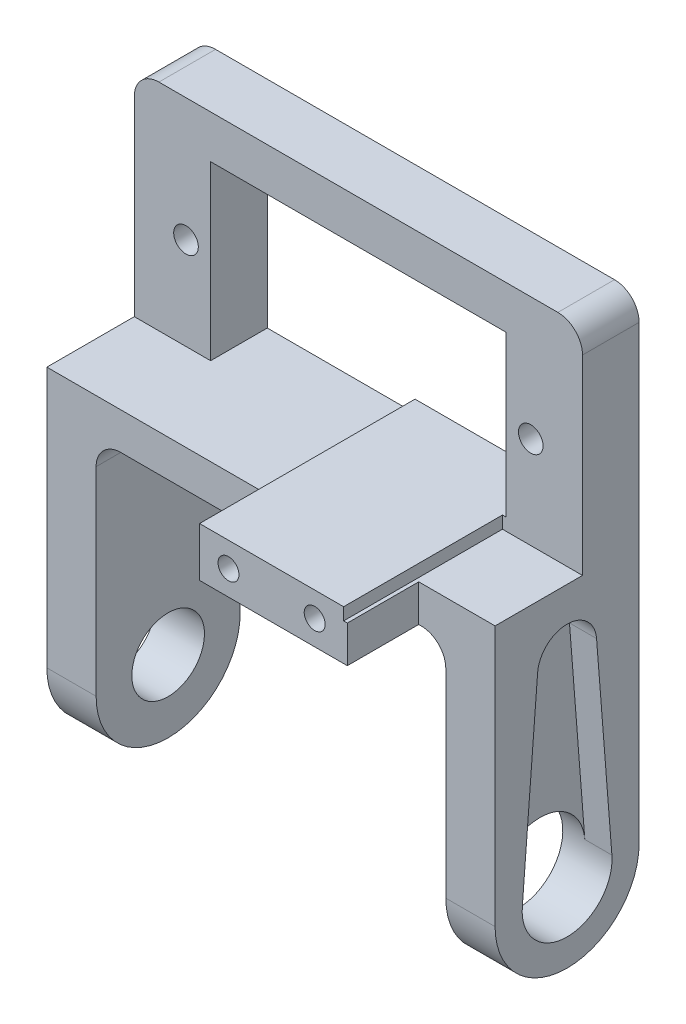
from build123d import *

# Parameters (mm, degrees)
SKETCH_1_R          = 1
EXTRUDE_1_DEPTH     = 4.6
EXTRUDE_2_DEPTH     = 11.7
SKETCH_1_4_W        = 12
SKETCH_1_4_H        = 3
EXTRUDE_3_DEPTH     = 11.7
SKETCH_2_R          = 3.65
CUT_EXTRUDE_1_DEPTH = 24.5
CUT_EXTRUDE_2_DEPTH = 2.2
FILLET_2_R          = 5.85
FILLET_3_R          = 5.85
FILLET_4_R          = 5.85
FILLET_1_R          = 5.85
FILLET_5_R          = 2
FILLET_6_R          = 2
FILLET_8_R          = 2
SKETCH_3_R          = 2.95
CUT_EXTRUDE_3_DEPTH = 10
SKETCH_1_6_R        = 0.85
EXTRUDE_5_DEPTH     = 17.5
FILLET_9_R          = 2
CUT_EXTRUDE_START   = -2.2
CUT_EXTRUDE_4_DEPTH = 2.2
CUT_EXTRUDE_START_2 = -10.2
SKETCH_4_3_R        = 3.65
SKETCH_4_3_R_2      = 2.95
CUT_EXTRUDE_5_DEPTH = 10.2
EXTRUDE_6_DEPTH     = 2.2
SKETCH_2_5_R        = 3.65
EXTRUDE_7_DEPTH     = 4
SKETCH_5_R          = 2.95
CUT_EXTRUDE_6_DEPTH = 8.2


with BuildPart() as part:
    # 草图1 → 凸台-拉伸1 (new body)
    with BuildSketch(Plane.XY):
        Polygon((0, 44.5), (0, 27), (6.2, 27), (6.2, 28), (6.2, 41), (30.2, 41), (30.2, 28), (29.9, 28), (29.9, 27), (30.2, 27), (35, 27), (36.4, 27), (36.4, 44.5), align=None)
        with Locations((4.2, 34.5)):
            Circle(SKETCH_1_R, mode=Mode.SUBTRACT)
        with Locations((32.2, 34.5)):
            Circle(SKETCH_1_R, mode=Mode.SUBTRACT)
    extrude(amount=EXTRUDE_1_DEPTH)

    # 草图1<3> → 凸台-拉伸2 (add)
    with BuildSketch(Plane.XY):
        Polygon((0, 27), (0, 0), (4, 0), (4, 24), (6.2, 24), (6.2, 27), align=None)
        Polygon((36.4, 0), (36.4, 27), (30.2, 27), (30.2, 24), (32.4, 24), (32.4, 0), align=None)
    extrude(amount=EXTRUDE_2_DEPTH)

    # 草图1<4> → 凸台-拉伸3 (add)
    with BuildSketch(Plane.XY):
        with Locations((12.2, 25.5)):
            Rectangle(SKETCH_1_4_W, SKETCH_1_4_H)
    extrude(amount=EXTRUDE_3_DEPTH)

    # 草图2 → 切除-拉伸1 (cut)
    with BuildSketch(Plane.ZY):
        with Locations((5.85, 5.85)):
            Circle(SKETCH_2_R)
    extrude(amount=-CUT_EXTRUDE_1_DEPTH, mode=Mode.SUBTRACT)

    # 草图2<3> → 切除-拉伸2 (cut)
    with BuildSketch(Plane.ZY):
        with BuildLine():
            Line((9.488773874, 6.136050157), (8.242618438, 21.988087774))
            ThreePointArc((8.242618438, 21.988087774), (5.85, 24.2), (3.457381562, 21.988087774))
            Line((3.457381562, 21.988087774), (2.211226126, 6.136050157))
            ThreePointArc((2.211226126, 6.136050157), (5.85, 9.5), (9.488773874, 6.136050157))
        make_face()
    extrude(amount=-CUT_EXTRUDE_2_DEPTH, mode=Mode.SUBTRACT)

    # 圆角2
    fillet_2_edges = [part.edges().sort_by_distance(p)[0] for p in [
        (2, 0, 0),
    ]]
    fillet(fillet_2_edges, radius=FILLET_2_R)

    # 圆角3
    fillet_3_edges = [part.edges().sort_by_distance(p)[0] for p in [
        (34.4, 0, 0),
    ]]
    fillet(fillet_3_edges, radius=FILLET_3_R)

    # 圆角4
    fillet_4_edges = [part.edges().sort_by_distance(p)[0] for p in [
        (34.4, 0, 11.7),
    ]]
    fillet(fillet_4_edges, radius=FILLET_4_R - 0.0001)  # a hair under: the kernel refuses the full size

    # 圆角1
    fillet_1_edges = [part.edges().sort_by_distance(p)[0] for p in [
        (2, 0, 11.7),
    ]]
    fillet(fillet_1_edges, radius=FILLET_1_R - 0.0001)  # a hair under: the kernel refuses the full size

    # 圆角5
    fillet_5_edges = [part.edges().sort_by_distance(p)[0] for p in [
        (0, 44.5, 2.3),
    ]]
    fillet(fillet_5_edges, radius=FILLET_5_R)

    # 圆角6
    fillet_6_edges = [part.edges().sort_by_distance(p)[0] for p in [
        (36.4, 44.5, 2.3),
    ]]
    fillet(fillet_6_edges, radius=FILLET_6_R)

    # 圆角8
    fillet_8_edges = [part.edges().sort_by_distance(p)[0] for p in [
        (4, 24, 5.85),
    ]]
    fillet(fillet_8_edges, radius=FILLET_8_R)

    # 草图3 → 切除-拉伸3 (cut)
    with BuildSketch(Plane(origin=(36.4, 0, 0), x_dir=(0, 0, -1), z_dir=(1, 0, 0))):
        with Locations(Location((-5.85, 5.85, 0), (0, 0, 90))):
            Circle(SKETCH_3_R)
    extrude(amount=-CUT_EXTRUDE_3_DEPTH, mode=Mode.SUBTRACT)

    # 草图1<6> → 凸台-拉伸5 (add)
    with BuildSketch(Plane.XY):
        Polygon((18.2, 28), (18.2, 27), (18.2, 24), (30.2, 24), (30.2, 27), (29.9, 27), (29.9, 28), align=None)
        with Locations((20.55, 26)):
            Circle(SKETCH_1_6_R, mode=Mode.SUBTRACT)
        with Locations((27.55, 26)):
            Circle(SKETCH_1_6_R, mode=Mode.SUBTRACT)
    extrude(amount=EXTRUDE_5_DEPTH)

    # 圆角9
    fillet_9_edges = [part.edges().sort_by_distance(p)[0] for p in [
        (32.4, 24, 5.85),
    ]]
    fillet(fillet_9_edges, radius=FILLET_9_R)

    # 草图4 → 切除-拉伸4 (cut)
    with BuildSketch(Plane(origin=(36.4, 0, 0), x_dir=(0, 0, -1), z_dir=(1, 0, 0)).offset(CUT_EXTRUDE_START)):
        with BuildLine():
            ThreePointArc((-3.457381562, 21.988087774), (-5.85, 24.2), (-8.242618438, 21.988087774))
            Line((-8.242618438, 21.988087774), (-9.488773874, 6.136050157))
            ThreePointArc((-9.488773874, 6.136050157), (-5.85, 9.5), (-2.211226126, 6.136050157))
            Line((-2.211226126, 6.136050157), (-3.457381562, 21.988087774))
        make_face()
    extrude(amount=CUT_EXTRUDE_4_DEPTH, mode=Mode.SUBTRACT)

    # 草图4<3> → 切除-拉伸5 (cut)
    with BuildSketch(Plane(origin=(36.4, 0, 0), x_dir=(0, 0, -1), z_dir=(1, 0, 0)).offset(CUT_EXTRUDE_START_2)):
        with Locations(Location((-5.85, 5.85, 0), (0, 0, 175.505125981))):
            Circle(SKETCH_4_3_R)
        with Locations((-5.85, 5.85)):
            Circle(SKETCH_4_3_R_2, mode=Mode.SUBTRACT)
    extrude(amount=CUT_EXTRUDE_5_DEPTH, mode=Mode.SUBTRACT)

    # 草图2<4> → 凸台-拉伸6 (add)
    with BuildSketch(Plane.ZY):
        with BuildLine():
            Line((9.488773874, 6.136050157), (8.242618438, 21.988087774))
            ThreePointArc((8.242618438, 21.988087774), (5.85, 24.2), (3.457381562, 21.988087774))
            Line((3.457381562, 21.988087774), (2.211226126, 6.136050157))
            ThreePointArc((2.211226126, 6.136050157), (5.85, 9.5), (9.488773874, 6.136050157))
        make_face()
    extrude(amount=-EXTRUDE_6_DEPTH)

    # 草图2<5> → 凸台-拉伸7 (add)
    with BuildSketch(Plane.ZY):
        with Locations(Location((5.85, 5.85, 0), (0, 0, 4.494874019))):
            Circle(SKETCH_2_5_R)
    extrude(amount=-EXTRUDE_7_DEPTH)

    # 草图5 → 切除-拉伸6 (cut)
    with BuildSketch(Plane.ZY):
        with Locations((5.85, 5.85)):
            Circle(SKETCH_5_R)
    extrude(amount=-CUT_EXTRUDE_6_DEPTH, mode=Mode.SUBTRACT)


solid = part.part
